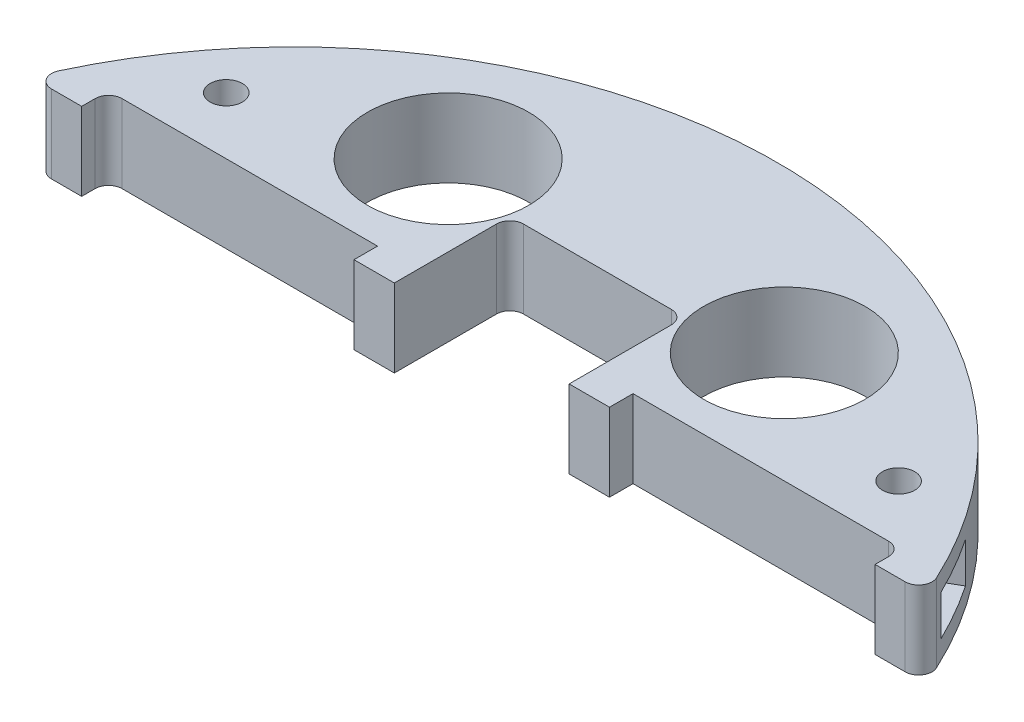
from build123d import *

# Parameters (mm, degrees)
BOSS_EXTRUDE1_DEPTH  = 5.8
SOLENOID_PLACEMENT_W = 38
SOLENOID_PLACEMENT_H = 64
CUT_EXTRUDE1_DEPTH   = 103.481998419
CUT_EXTRUDE4_DEPTH   = 103.481998419
SKETCH5_R            = 12
CUT_EXTRUDE5_DEPTH   = 103.481998419
SKETCH6_R            = 2.4
CUT_EXTRUDE6_DEPTH   = 103.481998419
CUT_EXTRUDE3_DEPTH   = 103.481998419
FILLET1_R            = 2
CUT_EXTRUDE7_DEPTH   = 3


with BuildPart() as part:
    # Sketch1 → Boss-Extrude1 (new, symmetric)
    with BuildSketch(Plane(origin=(0, 0, 0), x_dir=(1, 0, 0), z_dir=(0, 1, 0))):
        with BuildLine():
            ThreePointArc((36.224522061, -62.223661106), (0, 72), (-36.224522061, -62.223661106))
            ThreePointArc((-36.224522061, -62.223661106), (-32.797800029, -62.818856853), (-29.811944095, -61.035223988))
            ThreePointArc((-29.811944095, -61.035223988), (0, -46.75), (29.811944095, -61.035223988))
            ThreePointArc((29.811944095, -61.035223988), (32.797800029, -62.818856853), (36.224522061, -62.223661106))
        make_face()
    extrude(amount=BOSS_EXTRUDE1_DEPTH, both=True)

    # solenoid placement → Cut-Extrude1 (cut, through all)
    with BuildSketch(Plane(origin=(0, 5.8, 0), x_dir=(1, 0, 0), z_dir=(0, 1, 0))):
        with Locations((0, -4)):
            Rectangle(SOLENOID_PLACEMENT_W, SOLENOID_PLACEMENT_H)
    extrude(amount=-CUT_EXTRUDE1_DEPTH, mode=Mode.SUBTRACT)

    # Sketch4 → Cut-Extrude4 (cut, through all)
    with BuildSketch(Plane(origin=(0, 5.8, 0), x_dir=(1, 0, 0), z_dir=(0, 1, 0))):
        with BuildLine():
            Line((-13, 28), (13, 28))
            Line((13, 28), (13, 43.2))
            ThreePointArc((13, 43.2), (12.414213562, 44.614213562), (11, 45.2))
            Line((11, 45.2), (-11, 45.2))
            ThreePointArc((-11, 45.2), (-12.414213562, 44.614213562), (-13, 43.2))
            Line((-13, 43.2), (-13, 28))
        make_face()
    extrude(amount=-CUT_EXTRUDE4_DEPTH, mode=Mode.SUBTRACT)

    # Sketch5 → Cut-Extrude5 (cut, through all)
    with BuildSketch(Plane(origin=(0, 5.8, 0), x_dir=(1, 0, 0), z_dir=(0, 1, 0))):
        with Locations((25, 48)):
            Circle(SKETCH5_R)
        with Locations((-25, 48)):
            Circle(SKETCH5_R)
    extrude(amount=-CUT_EXTRUDE5_DEPTH, mode=Mode.SUBTRACT)

    # Sketch6 → Cut-Extrude6 (cut, through all)
    with BuildSketch(Plane(origin=(0, 5.8, 0), x_dir=(1, 0, 0), z_dir=(0, 1, 0))):
        with Locations((50, 40)):
            Circle(SKETCH6_R)
        with Locations((-50, 40)):
            Circle(SKETCH6_R)
    extrude(amount=-CUT_EXTRUDE6_DEPTH, mode=Mode.SUBTRACT)

    # Sketch3 → Cut-Extrude3 (cut, through all)
    with BuildSketch(Plane(origin=(0, 5.8, 0), x_dir=(1, 0, 0), z_dir=(0, 1, 0))):
        Polygon((-19, 28), (19, 28), (19, 31.5), (59, 31.5), (59, 27.5), (72, 27.5), (72, -31.5), (72, -101.646422462), (-72, -101.646422462), (-72, -31.5), (-72, 27.5), (-59, 27.5), (-59, 31.5), (-19, 31.5), align=None)
    extrude(amount=-CUT_EXTRUDE3_DEPTH, mode=Mode.SUBTRACT)

    # Fillet1
    fillet1_edges = [part.edges().sort_by_distance(p)[0] for p in [
        (-66.541340534, 0, -27.5),
        (-59, 0, -31.5),
        (59, 0, -31.5),
        (66.541340534, 0, -27.5),
    ]]
    fillet(fillet1_edges, radius=FILLET1_R)

    # Sketch8 → Cut-Extrude7 (cut, symmetric)
    with BuildSketch(Plane(origin=(0, 0, 0), x_dir=(1, 0, 0), z_dir=(0, 1, 0))):
        with BuildLine():
            Line((5, 71.826179071), (5, 68.926179071))
            Line((5, 68.926179071), (-5, 68.926179071))
            Line((-5, 68.926179071), (-5, 71.826179071))
            ThreePointArc((-5, 71.826179071), (0, 72), (5, 71.826179071))
        make_face()
        with BuildLine():
            Line((64.703295733, 31.582962517), (62.191822062, 30.132962517))
            Line((62.191822062, 30.132962517), (57.191822062, 38.793216555))
            Line((57.191822062, 38.793216555), (59.703295733, 40.243216555))
            ThreePointArc((59.703295733, 40.243216555), (62.353829072, 36), (64.703295733, 31.582962517))
        make_face()
        with BuildLine():
            Line((-59.703295733, 40.243216555), (-57.191822062, 38.793216555))
            Line((-57.191822062, 38.793216555), (-62.191822062, 30.132962517))
            Line((-62.191822062, 30.132962517), (-64.703295733, 31.582962517))
            ThreePointArc((-64.703295733, 31.582962517), (-62.353829072, 36), (-59.703295733, 40.243216555))
        make_face()
    extrude(amount=CUT_EXTRUDE7_DEPTH, both=True, mode=Mode.SUBTRACT)


solid = part.part
